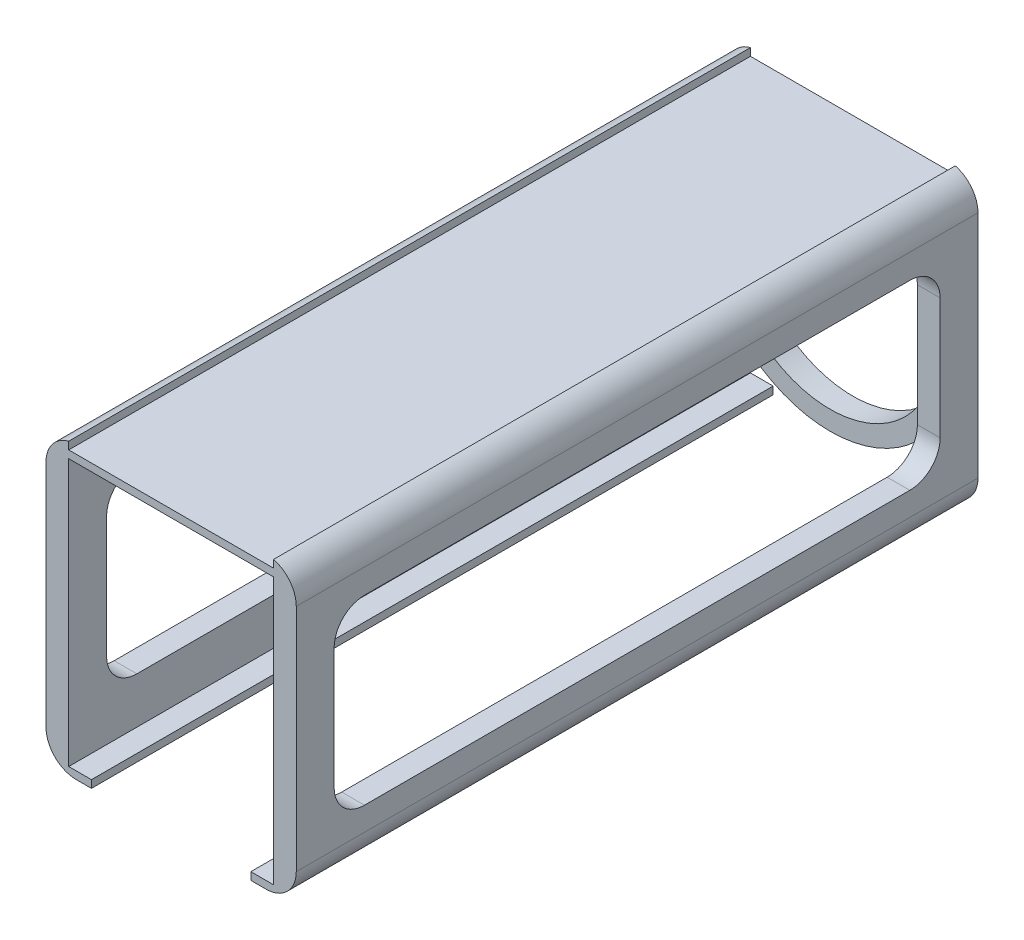
from build123d import *

# Parameters (mm, degrees)
SKETCH1_W             = 9.525
SKETCH1_H             = 142.875
BOSS_EXTRUDE1_DEPTH   = 1.5875
BOSS_EXTRUDE1_2_DEPTH = 1.5875
SKETCH2_W             = 4.7625
SKETCH2_H             = 142.875
BOSS_EXTRUDE2_DEPTH   = 59.055
SKETCH3_W             = 127
SKETCH3_H             = 38.1
CUT_EXTRUDE1_DEPTH    = 164.834934713
SKETCH4_R             = 26.2255
SKETCH4_R_2           = 22.225
BOSS_EXTRUDE3_DEPTH   = 4.7625
FILLET1_R             = 6.35
FILLET4_R             = 6.35
SKETCH5_W             = 44.45
SKETCH5_H             = 1.5875
BOSS_EXTRUDE4_DEPTH   = 142.875


with BuildPart() as part:
    # Sketch1 → Boss-Extrude1 (new body)
    with BuildSketch(Plane(origin=(0, 0, 0), x_dir=(1, 0, 0), z_dir=(0, 1, 0))):
        with Locations((4.7625, 71.4375)):
            Rectangle(SKETCH1_W, SKETCH1_H)
    extrude(amount=BOSS_EXTRUDE1_DEPTH)



with BuildPart() as body_2:
    # Sketch1 → Boss-Extrude1 2 (new body)
    with BuildSketch(Plane(origin=(0, 0, 0), x_dir=(1, 0, 0), z_dir=(0, 1, 0))):
        with Locations((47.6885, 71.4375)):
            Rectangle(SKETCH1_W, SKETCH1_H)
    extrude(amount=BOSS_EXTRUDE1_2_DEPTH)


with BuildPart() as part_1:
    add(part.part)

    add(body_2.part)  # Boss-Extrude2 merges body 2
    # Sketch2 → Boss-Extrude2 (add)
    with BuildSketch(Plane(origin=(0, 1.5875, 0), x_dir=(1, 0, 0), z_dir=(0, 1, 0))):
        with Locations((2.38125, 71.4375)):
            Rectangle(SKETCH2_W, SKETCH2_H)
        with Locations((50.06975, 71.4375)):
            Rectangle(SKETCH2_W, SKETCH2_H)
    extrude(amount=BOSS_EXTRUDE2_DEPTH)

    # Sketch3 → Cut-Extrude1 (cut, through all)
    with BuildSketch(Plane.ZY):
        with Locations((-71.4375, 30.32125)):
            Rectangle(SKETCH3_W, SKETCH3_H)
    extrude(amount=-CUT_EXTRUDE1_DEPTH, mode=Mode.SUBTRACT)

    # Sketch4 → Boss-Extrude3 (add)
    with BuildSketch(Plane(origin=(0, 0, -142.875), x_dir=(-1, 0, 0), z_dir=(0, 0, -1))):
        with Locations((-26.2255, 30.32125)):
            Circle(SKETCH4_R)
        with Locations((-26.2255, 30.32125)):
            Circle(SKETCH4_R_2, mode=Mode.SUBTRACT)
    extrude(amount=-BOSS_EXTRUDE3_DEPTH)

    # Fillet1
    # the kernel refuses this fillet: 6.35 mm, written as the material it takes off along each edge
    with BuildSketch(Plane(origin=(52.451, 0, -158.75), x_dir=(0, 1, 0), z_dir=(0, 0, 1)), Plane(origin=(0, 0, -158.75), x_dir=(1, 0, 0), z_dir=(0, 0, 1))) as fillet1_piece_1:
        with BuildLine():
            CenterArc((FILLET1_R, FILLET1_R), FILLET1_R, 180, 90)
            Line((0, FILLET1_R), (-FILLET1_R * 0.02, FILLET1_R))
            Line((-FILLET1_R * 0.02, FILLET1_R), (-FILLET1_R * 0.02, -FILLET1_R * 0.02))
            Line((-FILLET1_R * 0.02, -FILLET1_R * 0.02), (FILLET1_R, -FILLET1_R * 0.02))
            Line((FILLET1_R, -FILLET1_R * 0.02), (FILLET1_R, 0))
        make_face()
    extrude(amount=174.625, mode=Mode.SUBTRACT)
    with BuildSketch(Plane(origin=(0, 60.6425, -158.245902655), x_dir=(1, 0, 0), z_dir=(0, 0, 1))) as fillet1_piece_2:
        with BuildLine():
            CenterArc((6.35, -6.148361062), FILLET1_R, 104.477512186, 75.522487814)
            Line((0, -6.148361062), (-0.127, -6.148361062))
            Line((-0.127, -6.148361062), (-0.127, 0))
            Line((-0.127, 0), (0, 0.127))
            ThreePointArc((0, 0.127), (2.38125, 0.127), (4.73075, 0.122967221))
            Line((4.73075, 0.122967221), (4.7625, 0))
        make_face()
    extrude(amount=173.616805311, mode=Mode.SUBTRACT)
    with BuildSketch(Plane(origin=(52.451, 60.6425, -158.245902655), x_dir=(0, -1, 0), z_dir=(0, 0, 1))) as fillet1_piece_3:
        with BuildLine():
            CenterArc((6.148361062, -6.35), FILLET1_R, 90, 75.522487814)
            Line((0, -4.7625), (-0.122967221, -4.73075))
            ThreePointArc((-0.122967221, -4.73075), (-0.127, -2.38125), (-0.127, 0))
            Line((-0.127, 0), (0, 0.127))
            Line((0, 0.127), (6.148361062, 0.127))
            Line((6.148361062, 0.127), (6.148361062, 0))
        make_face()
    extrude(amount=173.616805311, mode=Mode.SUBTRACT)

    # Fillet4
    fillet4_edges = [part_1.edges().sort_by_distance(p)[0] for p in [
        (2.38125, 11.27125, -134.9375),
        (2.38125, 49.37125, -134.9375),
        (2.38125, 49.37125, -7.9375),
        (2.38125, 11.27125, -7.9375),
        (50.06975, 49.37125, -134.9375),
        (50.06975, 49.37125, -7.9375),
        (50.06975, 11.27125, -7.9375),
        (50.06975, 11.27125, -134.9375),
    ]]
    fillet(fillet4_edges, radius=FILLET4_R)

    # Sketch5 → Boss-Extrude4 (add)
    with BuildSketch(Plane.XY):
        with Locations((26.2255, 58.26125)):
            Rectangle(SKETCH5_W, SKETCH5_H)
    extrude(amount=-BOSS_EXTRUDE4_DEPTH)


solid = part_1.part
